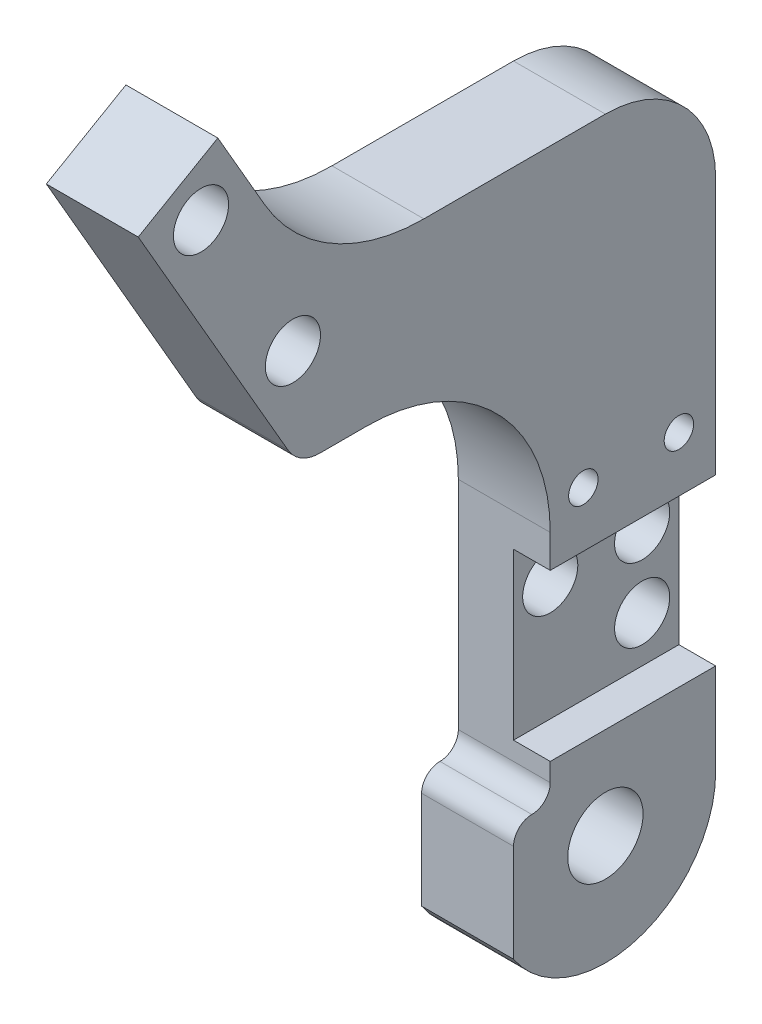
from build123d import *

# Parameters (mm, degrees)
SKETCH1_R                   = 2.05
SKETCH1_R_2                 = 1.5
BOSS_EXTRUDE1_DEPTH         = 5
FILLET1_START               = -1
FILLET1_DEPTH               = 7
FILLET1_2_DEPTH             = 5
TAP_DRILL_FOR_M2X0_4_TAP1_D = 1.6
SKETCH4_W                   = 9
SKETCH4_H                   = 9
CUT_EXTRUDE1_DEPTH          = 2
SKETCH5_R                   = 5
CUT_EXTRUDE2_DEPTH          = 3.5


with BuildPart() as part:
    # Sketch1 → Boss-Extrude1 (new body)
    with BuildSketch(Plane(origin=(0, 0, 0), x_dir=(0, 0, -1), z_dir=(1, 0, 0))):
        with BuildLine():
            Line((6, 0), (6, 28))
            ThreePointArc((6, 28), (4.242640687, 32.242640687), (0, 34))
            Line((0, 34), (-9.875644347, 34))
            ThreePointArc((-9.875644347, 34), (-14.875644347, 35.339745962), (-18.535898385, 39))
            Line((-18.535898385, 39), (-21.084936491, 43.415063509))
            Line((-21.084936491, 43.415063509), (-25.415063509, 40.915063509))
            Line((-25.415063509, 40.915063509), (-17.260063509, 26.790189174))
            ThreePointArc((-17.260063509, 26.790189174), (-16.528012702, 26.058138366), (-15.528012702, 25.790189174))
            Line((-15.528012702, 25.790189174), (-13, 25.790189174))
            ThreePointArc((-13, 25.790189174), (-5.928932188, 22.861256986), (-3, 15.790189174))
            Line((-3, 15.790189174), (-3, 3))
            Line((-3, 3), (-5, 3))
            Line((-5, 3), (-5, -3.31662479))
            ThreePointArc((-5, -3.31662479), (1.732050808, -5.744562647), (6, 0))
        make_face()
        Circle(SKETCH1_R, mode=Mode.SUBTRACT)
        with Locations((-22, 40)):
            Circle(SKETCH1_R_2, mode=Mode.SUBTRACT)
        with Locations((-17, 31.339745962)):
            Circle(SKETCH1_R_2, mode=Mode.SUBTRACT)
        with Locations((-1, 11.5)):
            Circle(SKETCH1_R_2, mode=Mode.SUBTRACT)
        with Locations((4, 11.5)):
            Circle(SKETCH1_R_2, mode=Mode.SUBTRACT)
        with Locations((4, 7.5)):
            Circle(SKETCH1_R_2, mode=Mode.SUBTRACT)
    extrude(amount=BOSS_EXTRUDE1_DEPTH)

    # Fillet1: read off the stored shape, not the designer's step
    # Fillet1 outline → Fillet1 (cut)
    with BuildSketch(Plane.YZ.offset(FILLET1_START)):
        with BuildLine():
            ThreePointArc((2, 5), (2.707106781, 4.707106781), (3, 4))
            Line((3, 4), (3, 5))
            Line((3, 5), (2, 5))
        make_face()
    extrude(amount=FILLET1_DEPTH, mode=Mode.SUBTRACT)

    # Fillet1 2 outline → Fillet1 2 (add)
    with BuildSketch(Plane.YZ):
        with BuildLine():
            ThreePointArc((4, 3), (3.292893219, 3.292893219), (3, 4))
            Line((3, 4), (3, 3))
            Line((3, 3), (4, 3))
        make_face()
    extrude(amount=FILLET1_2_DEPTH)

    # Tap Drill for M2x0.4 Tap1 (through all)
    with Locations(Plane(origin=(5, 0, 0), x_dir=(0, 0, -1), z_dir=(1, 0, 0))):
        with Locations((-1.2, 17), (4, 17)):
            Hole(TAP_DRILL_FOR_M2X0_4_TAP1_D / 2)

    # Sketch4 → Cut-Extrude1 (cut)
    with BuildSketch(Plane.ZY.offset(-5)):
        with Locations((-1.5, 9.5)):
            Rectangle(SKETCH4_W, SKETCH4_H)
    extrude(amount=CUT_EXTRUDE1_DEPTH, mode=Mode.SUBTRACT)

    # Sketch5 → Cut-Extrude2 (cut)
    with BuildSketch(Plane(origin=(0, 0, 0), x_dir=(0, 0, -1), z_dir=(1, 0, 0))):
        with Locations((0, 28)):
            Circle(SKETCH5_R)
    extrude(amount=CUT_EXTRUDE2_DEPTH, mode=Mode.SUBTRACT)


solid = part.part
